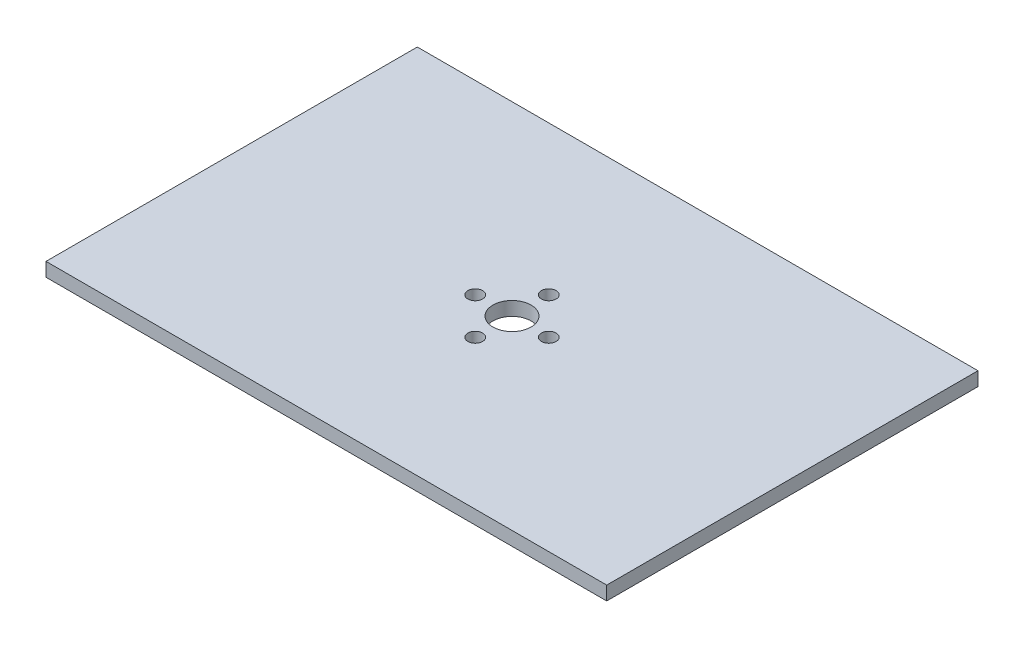
from build123d import *

# Parameters (mm, degrees)
SKETCH1_W           = 122
SKETCH1_H           = 80.79
SKETCH1_R           = 1.6
SKETCH1_R_2         = 4.15
BOSS_EXTRUDE1_DEPTH = 3


with BuildPart() as part:
    # Sketch1 → Boss-Extrude1 (new body)
    with BuildSketch(Plane(origin=(0, 0, 0), x_dir=(1, 0, 0), z_dir=(0, 1, 0))):
        with Locations((61, 40.395)):
            Rectangle(SKETCH1_W, SKETCH1_H)
        with Locations((53, 40.395)):
            Circle(SKETCH1_R, mode=Mode.SUBTRACT)
        with Locations((61, 48.395)):
            Circle(SKETCH1_R, mode=Mode.SUBTRACT)
        with Locations((69, 40.395)):
            Circle(SKETCH1_R, mode=Mode.SUBTRACT)
        with Locations((61, 32.395)):
            Circle(SKETCH1_R, mode=Mode.SUBTRACT)
        with Locations((61, 40.395)):
            Circle(SKETCH1_R_2, mode=Mode.SUBTRACT)
    extrude(amount=BOSS_EXTRUDE1_DEPTH)


solid = part.part
